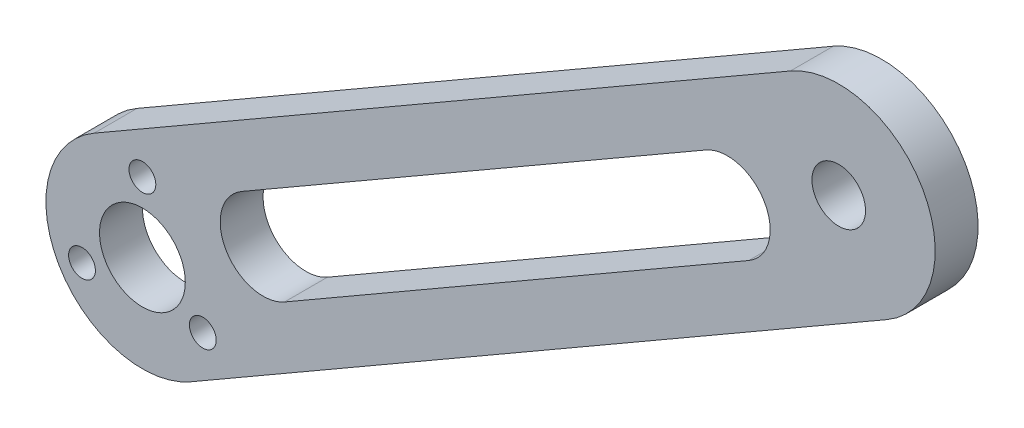
from build123d import *

# Parameters (mm, degrees)
SKETCH1_R           = 2.5
SKETCH1_R_2         = 4
SKETCH1_R_3         = 1.25
BOSS_EXTRUDE1_DEPTH = 4
CUT_EXTRUDE1_DEPTH  = 10


with BuildPart() as part:
    # Sketch1 → Boss-Extrude1 (new body)
    with BuildSketch(Plane.XY):
        with BuildLine():
            Line((4.5, -7.794228634), (69.451905284, 29.705771366))
            ThreePointArc((69.451905284, 29.705771366), (72.746133918, 42), (60.451905284, 45.294228634))
            Line((60.451905284, 45.294228634), (-4.5, 7.794228634))
            ThreePointArc((-4.5, 7.794228634), (-7.794228634, -4.5), (4.5, -7.794228634))
        make_face()
        with Locations((64.951905284, 37.5)):
            Circle(SKETCH1_R, mode=Mode.SUBTRACT)
        Circle(SKETCH1_R_2, mode=Mode.SUBTRACT)
        with Locations((0, 6.505402357)):
            Circle(SKETCH1_R_3, mode=Mode.SUBTRACT)
        with Locations((-5.633843703, -3.252701179)):
            Circle(SKETCH1_R_3, mode=Mode.SUBTRACT)
        with Locations((5.633843703, -3.252701179)):
            Circle(SKETCH1_R_3, mode=Mode.SUBTRACT)
    extrude(amount=BOSS_EXTRUDE1_DEPTH)

    # Sketch2 → Cut-Extrude1 (cut)
    with BuildSketch(Plane.XY.offset(4)):
        with BuildLine():
            Line((9.258330249, 9.964101615), (52.559600438, 34.964101615))
            ThreePointArc((52.559600438, 34.964101615), (58.023702054, 33.5), (56.559600438, 28.035898385))
            Line((56.559600438, 28.035898385), (13.258330249, 3.035898385))
            ThreePointArc((13.258330249, 3.035898385), (7.794228634, 4.5), (9.258330249, 9.964101615))
        make_face()
    extrude(amount=-CUT_EXTRUDE1_DEPTH, mode=Mode.SUBTRACT)


solid = part.part
